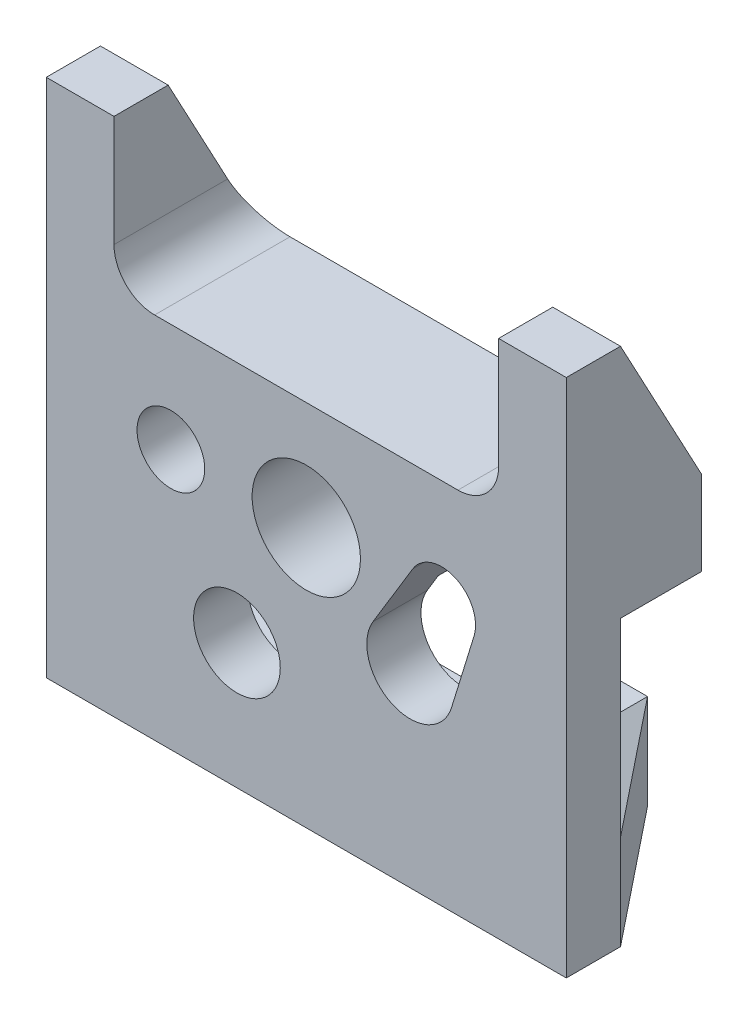
from build123d import *

# Parameters (mm, degrees)
OUTER_FRAME_EXTRUDE_DEPTH      = 5
OUTER_FRAME_EXTRUDE_DEPTH_BACK = 2
OUTSIDE_FRAME_W                = 19.2
OUTSIDE_FRAME_H                = 19.2
OUTSIDE_FRAME_W_2              = 14.2
OUTSIDE_FRAME_H_2              = 14.2
HOTSWAP_BASE_W                 = 19.2
HOTSWAP_BASE_H                 = 13.6
HOTSWAP_BASE_BLOCK_DEPTH       = 5
CUT_EXTRUDE4_DEPTH             = 17.288646353
CUT_EXTRUDE4_DEPTH_BACK        = 17.288646353
SKETCH1_W                      = 2
SKETCH1_H                      = 5.6
CUT_EXTRUDE1_DEPTH             = 4
SWITCH_PIN_HOLES_R             = 2
SWITCH_PIN_HOLES_R_2           = 1.25
SWITCH_HOLES_DEPTH             = 4
HOTSWAP_HOLES_R                = 1.6
CUT_EXTRUDE3_DEPTH             = 17.288646353
CHAMFER1_SIZE                  = 2
BOSS_EXTRUDE2_DEPTH            = 2.5
BOSS_EXTRUDE3_DEPTH            = 2.5
FILLET1_R                      = 0.35
FILLET2_R                      = 1.5
SPLIT1_START                   = -4
SPLIT1_OUTLINE_W               = 19.2
SPLIT1_OUTLINE_H               = 19.2
SPLIT1_OUTLINE_W_2             = 14.2
SPLIT1_OUTLINE_H_2             = 14.2
SPLIT1_DEPTH                   = 5
CHAMFER2_SIZE                  = 2
CHAMFER2_SIZE2                 = 2.998873489


# Read off the part's stored shape, not the designer's step: Split1
with BuildPart() as part:
    # Outside Frame → Outer Frame Extrude (new, two sides: drawn at the far end of the back side and taken through both)
    with BuildSketch(Plane.XY.offset(-4).offset(-OUTER_FRAME_EXTRUDE_DEPTH_BACK)):
        Rectangle(OUTSIDE_FRAME_W, OUTSIDE_FRAME_H)
        Rectangle(OUTSIDE_FRAME_W_2, OUTSIDE_FRAME_H_2, mode=Mode.SUBTRACT)
    extrude(amount=OUTER_FRAME_EXTRUDE_DEPTH + OUTER_FRAME_EXTRUDE_DEPTH_BACK)

    # Hotswap Base → Hotswap Base Block (add)
    with BuildSketch(Plane.XY.offset(-4)):
        with Locations((0, -2.8)):
            Rectangle(HOTSWAP_BASE_W, HOTSWAP_BASE_H)
    extrude(amount=-HOTSWAP_BASE_BLOCK_DEPTH)

    # Sketch1 → Cut-Extrude4 (cut, two sides: drawn at the far end of the back side and taken through both)
    with BuildSketch(Plane(origin=(0, 0, 0), x_dir=(0, 0, -1), z_dir=(1, 0, 0)).offset(-CUT_EXTRUDE4_DEPTH_BACK)):
        with Locations((5, 6.8)):
            Rectangle(SKETCH1_W, SKETCH1_H)
    extrude(amount=CUT_EXTRUDE4_DEPTH + CUT_EXTRUDE4_DEPTH_BACK, mode=Mode.SUBTRACT)

    # Hotswap Well → Cut-Extrude1 (cut)
    with BuildSketch(Plane(origin=(0, 0, -6), x_dir=(-1, 0, 0), z_dir=(0, 0, -1))):
        with BuildLine():
            Line((-10, -1.1), (-2.355843798, -1.1))
            ThreePointArc((-2.355843798, -1.1), (-1.396424004, -2.19317122), (0, -2.6))
            Line((0, -2.6), (5, -2.6))
            Line((5, -2.6), (5, -3.35))
            Line((5, -3.35), (10, -3.35))
            Line((10, -3.35), (10, -6.9))
            Line((10, -6.9), (-6, -6.9))
            Line((-6, -6.9), (-6, -4.1))
            Line((-6, -4.1), (-10, -4.1))
            Line((-10, -4.1), (-10, -1.1))
        make_face()
    extrude(amount=CUT_EXTRUDE1_DEPTH, mode=Mode.SUBTRACT)

    # Switch Pin Holes → Switch Holes (cut)
    with BuildSketch(Plane.XY.offset(-4)):
        Circle(SWITCH_PIN_HOLES_R)
        with Locations((-5, 0)):
            Circle(SWITCH_PIN_HOLES_R_2)
        with Locations((5, 0)):
            Circle(SWITCH_PIN_HOLES_R_2)
    extrude(amount=-SWITCH_HOLES_DEPTH, mode=Mode.SUBTRACT)

    # Hotswap Holes → Cut-Extrude3 (cut, through all)
    with BuildSketch(Plane.XY):
        with Locations((-2.560136595, -4.965291588)):
            Circle(HOTSWAP_HOLES_R)
        with BuildLine():
            Line((3.930924016, 0.647747281), (2.46548889, -1.77088348))
            ThreePointArc((2.46548889, -1.77088348), (3.179147124, -4.059894044), (5.3631684, -3.070485887))
            Line((5.3631684, -3.070485887), (6.194736133, -0.367567099))
            ThreePointArc((6.194736133, -0.367567099), (5.511530489, 1.140542222), (3.930924016, 0.647747281))
        make_face()
    extrude(amount=-CUT_EXTRUDE3_DEPTH, mode=Mode.SUBTRACT)

    # Chamfer1
    chamfer1_edges = [part.edges().sort_by_distance(p)[0] for p in [
        (9.6, -4.1, -7.5),
        (-9.6, -6.9, -7.5),
        (-9.6, -3.35, -7.5),
        (9.6, -1.1, -7.5),
    ]]
    chamfer(chamfer1_edges, length=CHAMFER1_SIZE)

    # Sketch2 → Boss-Extrude2 (add)
    with BuildSketch(Plane(origin=(9.6, 0, 0), x_dir=(0, 0, -1), z_dir=(1, 0, 0))):
        Polygon((6, 9.6), (9, 4), (4, 4), (4, 9.6), align=None)
    extrude(amount=-BOSS_EXTRUDE2_DEPTH)

    # Sketch3 → Boss-Extrude3 (add)
    with BuildSketch(Plane.ZY.offset(9.6)):
        Polygon((-4, 9.6), (-6, 9.6), (-9, 4), (-4, 4), align=None)
    extrude(amount=-BOSS_EXTRUDE3_DEPTH)

    # Fillet1
    fillet1_edges = [part.edges().sort_by_distance(p)[0] for p in [
        (6, -4.1, -7.5),
        (-5, -3.35, -7.5),
        (-5, -2.6, -7.5),
        (6, -6.9, -7.5),
        (2.355843798, -1.1, -7.5),
    ]]
    fillet(fillet1_edges, radius=FILLET1_R)

    # Fillet2
    fillet2_edges = [part.edges().sort_by_distance(p)[0] for p in [
        (7.1, 4, -6.5),
        (-7.1, 4, -6.5),
    ]]
    fillet(fillet2_edges, radius=FILLET2_R)

    # Split1 outline → Split1 (cut)
    with BuildSketch(Plane.XY.offset(SPLIT1_START)):
        Rectangle(SPLIT1_OUTLINE_W, SPLIT1_OUTLINE_H)
        Rectangle(SPLIT1_OUTLINE_W_2, SPLIT1_OUTLINE_H_2, mode=Mode.SUBTRACT)
    extrude(amount=SPLIT1_DEPTH, mode=Mode.SUBTRACT)

    # Chamfer2
    chamfer2_edges = [part.edges().sort_by_distance(p)[0] for p in [
        (9.6, -7.85, -9),
        (0, -9.6, -9),
    ]]
    chamfer2_side = [part.faces().sort_by_distance(p)[0] for p in [
        (1.357387596, -7.916485347, -9),
    ]]
    chamfer(chamfer2_edges, length=CHAMFER2_SIZE, length2=CHAMFER2_SIZE2, reference=chamfer2_side[0])


solid = part.part
